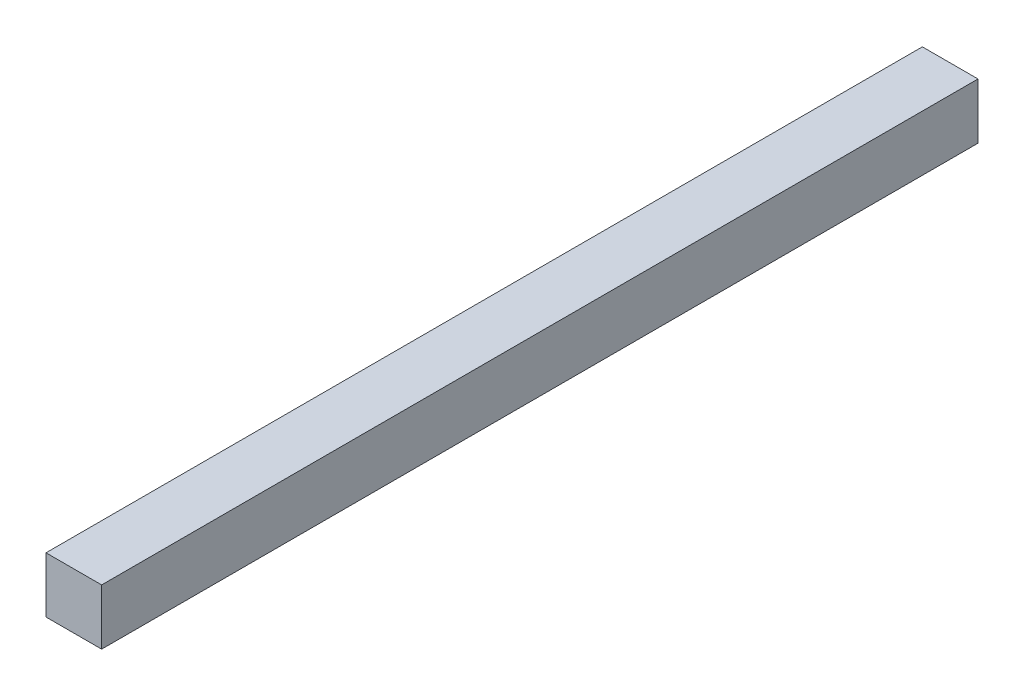
from build123d import *

# Parameters (mm, degrees)
SKETCH1_W           = 12.7
SKETCH1_H           = 12.7
BOSS_EXTRUDE1_DEPTH = 200


with BuildPart() as part:
    # Sketch1 → Boss-Extrude1 (new body)
    with BuildSketch(Plane.XY):
        Rectangle(SKETCH1_W, SKETCH1_H)
    extrude(amount=BOSS_EXTRUDE1_DEPTH)


solid = part.part
